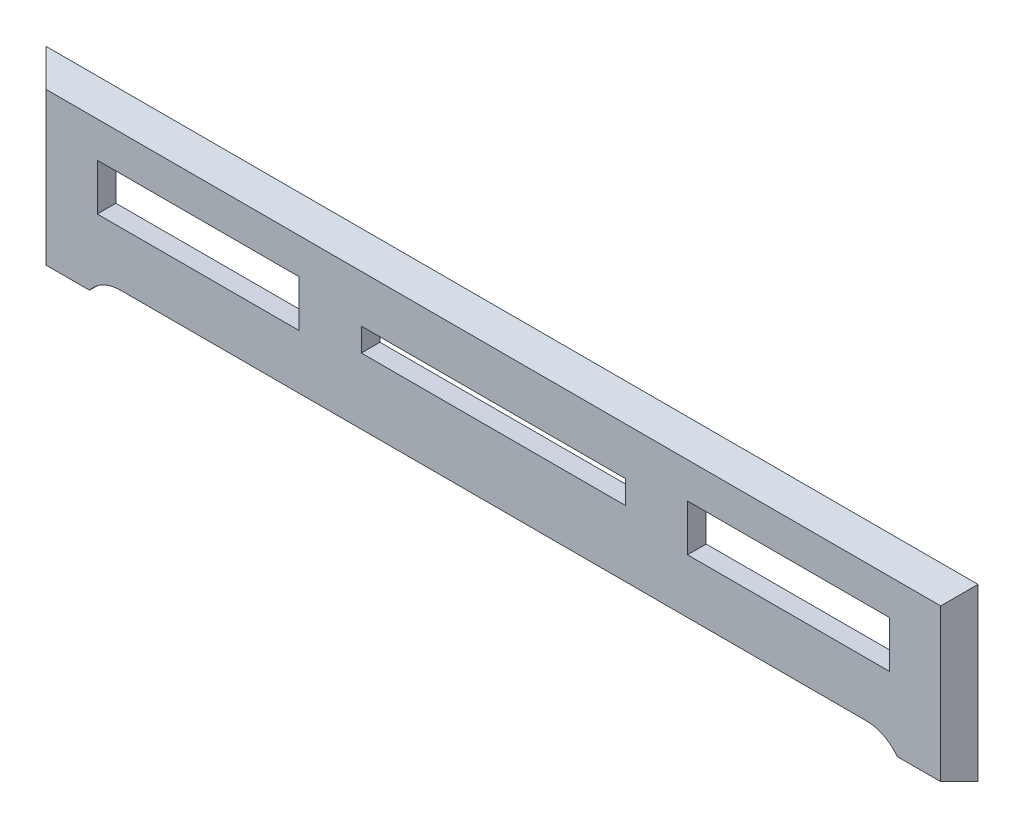
from build123d import *

# Parameters (mm, degrees)
BOSS_EXTRUDE1_DEPTH = 12
SKETCH2_W           = 130
SKETCH2_H           = 30
SKETCH2_W_2         = 170
SKETCH2_H_2         = 15
CUT_EXTRUDE1_DEPTH  = 609.394608786
CHAMFER1_SIZE       = 12


with BuildPart() as part:
    # Sketch1 → Boss-Extrude1 (new body)
    with BuildSketch(Plane.XY):
        with BuildLine():
            Line((0, 0), (0, -10))
            Line((0, -10), (40, -10))
            ThreePointArc((40, -10), (48.819660113, -2.639320225), (60, 0))
            Line((60, 0), (540, 0))
            ThreePointArc((540, 0), (551.180339887, -2.639320225), (560, -10))
            Line((560, -10), (600, -10))
            Line((600, -10), (600, 0))
            Line((600, 0), (600, 100))
            Line((600, 100), (0, 100))
            Line((0, 100), (0, 0))
        make_face()
    extrude(amount=BOSS_EXTRUDE1_DEPTH)

    # Sketch2 → Cut-Extrude1 (cut, through all)
    with BuildSketch(Plane.XY.offset(12)):
        with Locations((110, 50)):
            Rectangle(SKETCH2_W, SKETCH2_H)
        with Locations((300, 50)):
            Rectangle(SKETCH2_W_2, SKETCH2_H_2)
        with Locations((490, 50)):
            Rectangle(SKETCH2_W, SKETCH2_H)
    extrude(amount=-CUT_EXTRUDE1_DEPTH, mode=Mode.SUBTRACT)

    # Chamfer1
    chamfer1_edges = [part.edges().sort_by_distance(p)[0] for p in [
        (600, 45, 12),
        (300, 100, 12),
        (0, 45, 12),
    ]]
    chamfer(chamfer1_edges, length=CHAMFER1_SIZE - 0.0001)  # a hair under: the kernel refuses the full size


solid = part.part
